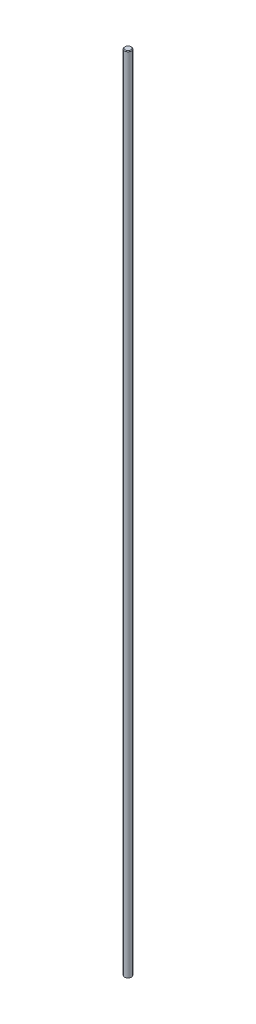
from build123d import *

# Parameters (mm, degrees)
SKETCH1_R           = 2
BOSS_EXTRUDE1_DEPTH = 352.25


# Read off the part's stored shape, not the designer's step: M3x0.5 Machine Threads Stud1
with BuildPart() as part:
    # Sketch1 → Boss-Extrude1 (new body)
    with BuildSketch(Plane(origin=(0, 0, 0), x_dir=(1, 0, 0), z_dir=(0, 1, 0))):
        with Locations(Location((0, 0, 0), (0, 0, 90))):
            Circle(SKETCH1_R)
    extrude(amount=BOSS_EXTRUDE1_DEPTH)

    # M3x0.5 Machine Threads Stud1 outline → M3x0.5 Machine Threads Stud1 (revolve, cut)
    with BuildSketch(Plane.XY):
        Polygon((2, 352.25), (1.2195, 352.25), (1.5, 351.9695), (1.5, 0), (2, 0), align=None)
    revolve(axis=Axis((0, 0, 0), (0, 1, 0)), mode=Mode.SUBTRACT)


solid = part.part
